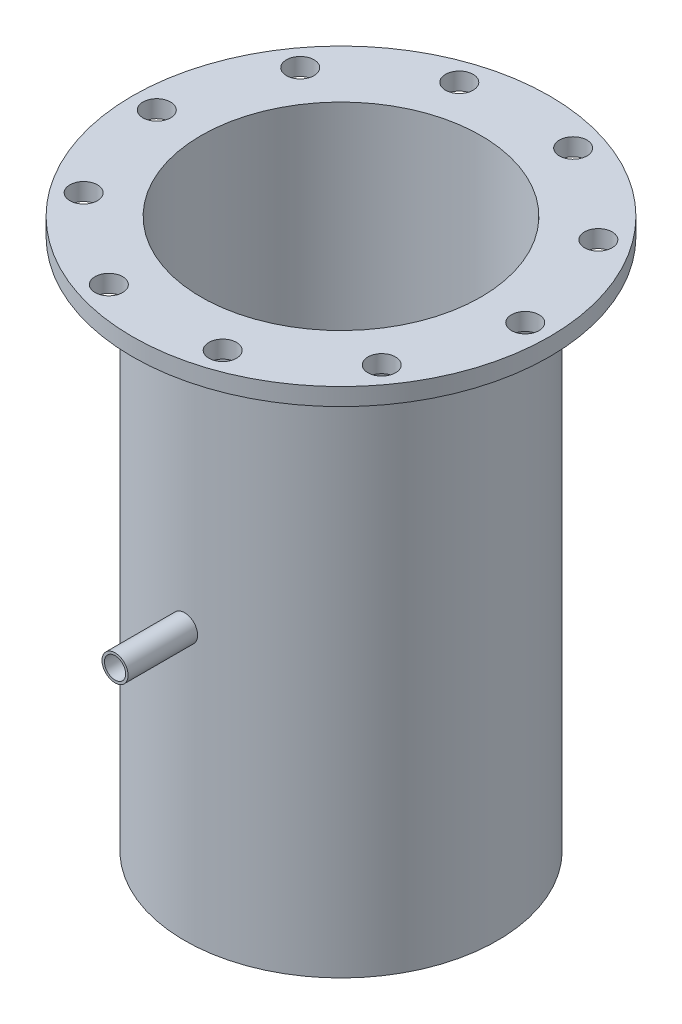
from build123d import *

# Parameters (mm, degrees)
TAP_DRILL_FOR_3_8_16_TAP1_D = 10.0838
CIRPATTERN1_COUNT           = 10
SKETCH4_R                   = 4.7625
SKETCH4_R_2                 = 3.8735
BOSS_EXTRUDE1_DEPTH         = 25.4


with BuildPart() as part:
    # Sketch1 → Revolve1 (revolve)
    with BuildSketch(Plane.XY):
        Polygon((51.1302, 0), (51.1302, -170.805763516), (53.6194, -170.805763516), (53.6194, -175.606363516), (51.1302, -175.606363516), (51.1302, -179.416363516), (53.6194, -179.416363516), (53.6194, -184.216963516), (51.1302, -184.216963516), (51.1302, -188.026963516), (53.848, -188.026963516), (53.848, -191.074963516), (51.1302, -191.074963516), (51.1302, -200.599963516), (57.15, -200.599963516), (57.15, -8.89), (54.61, -6.35), (76.2, -6.35), (76.2, 0), align=None)
    revolve(axis=Axis((0, 0, 0), (0, -1, 0)))

    # Tap Drill for 3/8-16 Tap1 (through all)
    with Locations(Plane(origin=(0, 0, 0), x_dir=(1, 0, 0), z_dir=(0, 1, 0))):
        with Locations((67.31, 0)):
            tap_drill_for_3_8_16_tap1 = Hole(TAP_DRILL_FOR_3_8_16_TAP1_D / 2)

    # CirPattern1: Tap Drill for 3/8-16 Tap1 ×10 about axis
    cirpattern1_axis = Axis((0, 0, 0), (0, 1, 0))
    for i in range(1, CIRPATTERN1_COUNT):
        add(tap_drill_for_3_8_16_tap1.rotate(cirpattern1_axis, i * 360 / CIRPATTERN1_COUNT), mode=Mode.SUBTRACT)

    # Sketch11 → 1/8 (0.125) Diameter Hole3 (revolve, cut)
    with BuildSketch(Plane(origin=(0, -101.6, 57.15), x_dir=(0, -1, 0), z_dir=(1, 0, 0))):
        Polygon((0, 0), (0, 26.353866233), (1.5875, 25.4), (1.5875, 0), align=None)
    revolve(axis=Axis((0, -101.6, 63.5), (0, 0, -1)), mode=Mode.SUBTRACT)


with BuildPart() as body_2:
    # Sketch4 → Boss-Extrude1 (new body)
    with BuildSketch(Plane.XY.offset(57.15)):
        with Locations((0, -101.6)):
            Circle(SKETCH4_R)
        with Locations((0, -101.6)):
            Circle(SKETCH4_R_2, mode=Mode.SUBTRACT)
    extrude(amount=BOSS_EXTRUDE1_DEPTH)


solid = Compound([part.part, body_2.part])
